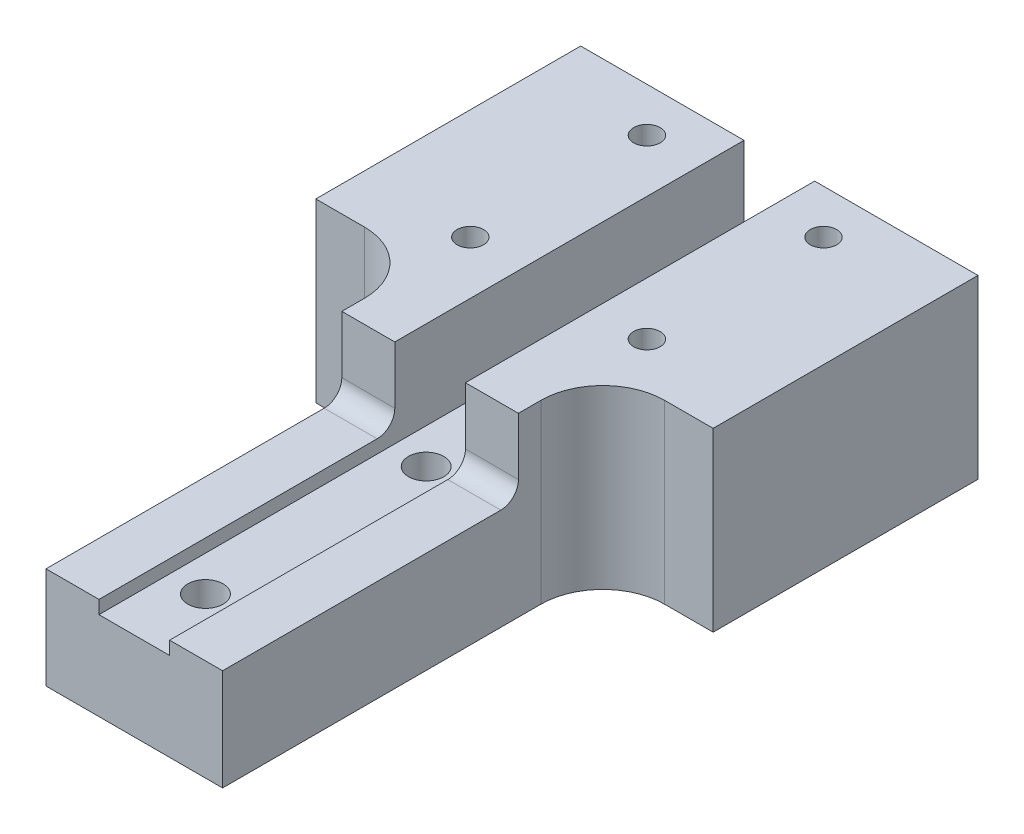
from build123d import *

# Parameters (mm, degrees)
SKETCH1_R           = 1.5
SKETCH1_R_2         = 2
BOSS_EXTRUDE2_DEPTH = 20
SKETCH5_W           = 8
SKETCH5_H           = 100
CUT_EXTRUDE1_DEPTH  = 10
FILLET1_R           = 7
SKETCH7_W           = 29.697028674
SKETCH7_H           = 34.988499238
CUT_EXTRUDE2_DEPTH  = 64.31883257
FILLET3_R           = 2


with BuildPart() as part:
    # Sketch1 → Boss-Extrude2 (new body)
    with BuildSketch(Plane(origin=(0, 0, 0), x_dir=(1, 0, 0), z_dir=(0, 1, 0))):
        Polygon((22.5, 15), (-22.5, 15), (-22.5, -15), (-10, -15), (-10, -58.058371989), (10, -58.058371989), (10, -15), (22.5, -15), align=None)
        with Locations((-10, -10)):
            Circle(SKETCH1_R, mode=Mode.SUBTRACT)
        with Locations((-10, 10)):
            Circle(SKETCH1_R, mode=Mode.SUBTRACT)
        with Locations((10, -10)):
            Circle(SKETCH1_R, mode=Mode.SUBTRACT)
        with Locations((10, 10)):
            Circle(SKETCH1_R, mode=Mode.SUBTRACT)
        with Locations((0, -25)):
            Circle(SKETCH1_R_2, mode=Mode.SUBTRACT)
        with Locations((0, -50)):
            Circle(SKETCH1_R_2, mode=Mode.SUBTRACT)
    extrude(amount=-BOSS_EXTRUDE2_DEPTH)

    # Sketch5 → Cut-Extrude1 (cut)
    with BuildSketch(Plane(origin=(0, 0, 0), x_dir=(1, 0, 0), z_dir=(0, 1, 0))):
        with Locations((0, -16.465194583)):
            Rectangle(SKETCH5_W, SKETCH5_H)
    extrude(amount=-CUT_EXTRUDE1_DEPTH, mode=Mode.SUBTRACT)

    # Fillet1
    fillet1_edges = [part.edges().sort_by_distance(p)[0] for p in [
        (-10, -10, 15),
        (10, -10, 15),
    ]]
    fillet(fillet1_edges, radius=FILLET1_R)

    # Sketch7 → Cut-Extrude2 (cut, through all)
    with BuildSketch(Plane(origin=(0, -8.5, 0), x_dir=(1, 0, 0), z_dir=(0, 1, 0))):
        with Locations((-0.809918964, -42.047133079)):
            Rectangle(SKETCH7_W, SKETCH7_H)
    extrude(amount=CUT_EXTRUDE2_DEPTH, mode=Mode.SUBTRACT)

    # Fillet3
    fillet3_edges = [part.edges().sort_by_distance(p)[0] for p in [
        (7, -8.5, 24.55288346),
        (-7, -8.5, 24.55288346),
    ]]
    fillet(fillet3_edges, radius=FILLET3_R)


solid = part.part
